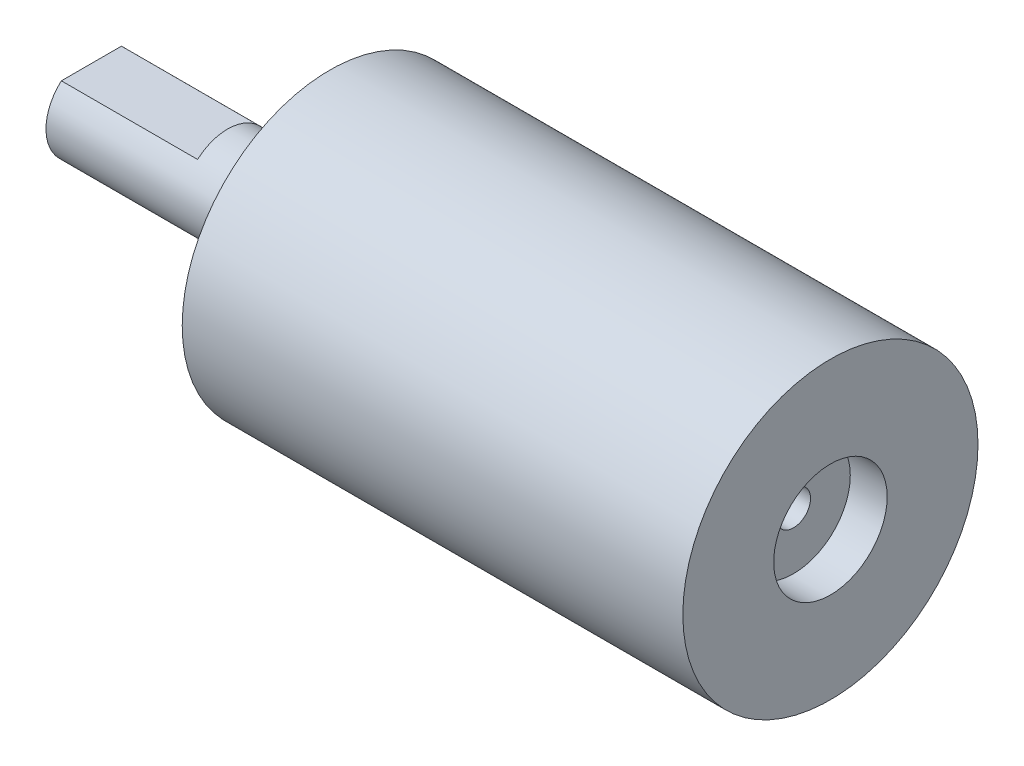
from build123d import *

# Parameters (mm, degrees)
SZKIC2_R                   = 1
WYTNIJ_WYCI_GNI_CIE1_DEPTH = 3.6
WYTNIJ_WYCI_GNI_CIE2_START = -12
WYTNIJ_WYCI_GNI_CIE2_DEPTH = 12


with BuildPart() as part:
    # Szkic1 → Obrót1 (revolve)
    with BuildSketch(Plane.XY):
        Polygon((0, 0), (0, 4), (19, 4), (19, 9.5), (21, 9.5), (21, 13), (65.1, 13), (65.1, 5), (61.85, 5), (61.85, 1.5), (54.1, 1.5), (54.1, 0), align=None)
    revolve(axis=Axis((0, 0, 0), (-1, 0, 0)))

    # Szkic2 → Wytnij-wyciągnięcie1 (cut)
    with BuildSketch(Plane.ZY.offset(-21)):
        with Locations((0, 11.25)):
            Circle(SZKIC2_R)
        with Locations((9.742785793, 5.625)):
            Circle(SZKIC2_R)
        with Locations((9.742785793, -5.625)):
            Circle(SZKIC2_R)
        with Locations((0, -11.25)):
            Circle(SZKIC2_R)
        with Locations((-9.742785793, -5.625)):
            Circle(SZKIC2_R)
        with Locations((-9.742785793, 5.625)):
            Circle(SZKIC2_R)
    extrude(amount=-WYTNIJ_WYCI_GNI_CIE1_DEPTH, mode=Mode.SUBTRACT)

    # Szkic3 → Wytnij-wyciągnięcie2 (cut)
    with BuildSketch(Plane.ZY.offset(WYTNIJ_WYCI_GNI_CIE2_START)):
        with BuildLine():
            Line((-2.645751311, 3), (2.645751311, 3))
            ThreePointArc((2.645751311, 3), (0, 4), (-2.645751311, 3))
        make_face()
    extrude(amount=WYTNIJ_WYCI_GNI_CIE2_DEPTH, mode=Mode.SUBTRACT)


solid = part.part
